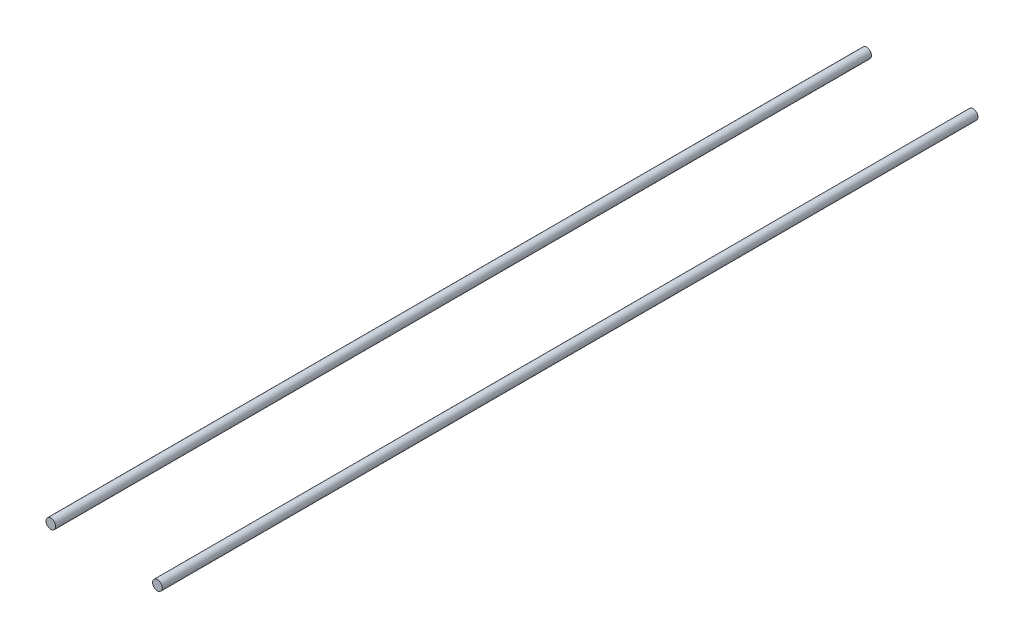
from build123d import *

# Parameters (mm, degrees)
BOSS_EXTRUDE2_DEPTH        = 100
BOSS_EXTRUDE2_DEPTH_BACK   = 903.2
SKETCH1_R                  = 6
BOSS_EXTRUDE2_2_DEPTH      = 100
BOSS_EXTRUDE2_2_DEPTH_BACK = 903.2


with BuildPart() as part:
    # Sketch1 → Boss-Extrude2 (new, two sides: drawn at the far end of the back side and taken through both)
    with BuildSketch(Plane(origin=(0, 0, 200), x_dir=(-1, 0, 0), z_dir=(0, 0, -1)).offset(-BOSS_EXTRUDE2_DEPTH_BACK)):
        with Locations((-65.5, -30.887752409)):
            Circle(SKETCH1_R)
    extrude(amount=BOSS_EXTRUDE2_DEPTH + BOSS_EXTRUDE2_DEPTH_BACK)


with BuildPart() as body_2:
    # Sketch1 → Boss-Extrude2 2 (new, two sides: drawn at the far end of the back side and taken through both)
    with BuildSketch(Plane(origin=(0, 0, 200), x_dir=(-1, 0, 0), z_dir=(0, 0, -1)).offset(-BOSS_EXTRUDE2_2_DEPTH_BACK)):
        with Locations((65.5, -30.887752409)):
            Circle(SKETCH1_R)
    extrude(amount=BOSS_EXTRUDE2_2_DEPTH + BOSS_EXTRUDE2_2_DEPTH_BACK)


solid = Compound([part.part, body_2.part])
